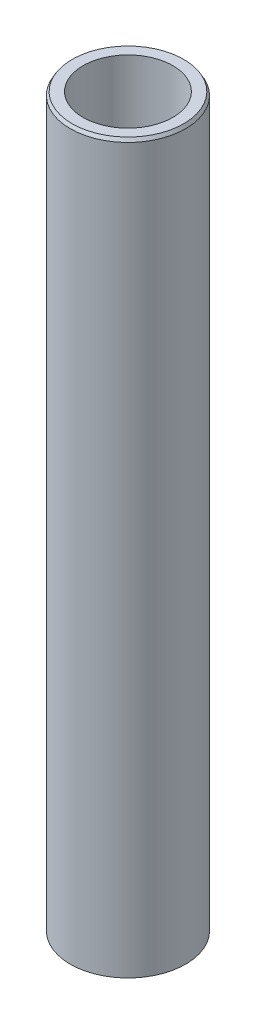
from build123d import *
from OCP.BRepFilletAPI import BRepFilletAPI_MakeChamfer

# Parameters (mm, degrees)
SKETCH1_R           = 47.5
BOSS_EXTRUDE1_DEPTH = 600
SKETCH2_R           = 36.948409672
CUT_EXTRUDE1_DEPTH  = 604.748706003
CHAMFER1_SIZE       = 2.745492763
CHAMFER1_SIZE2      = 1.585110986


with BuildPart() as part:
    # Sketch1 → Boss-Extrude1 (new body)
    with BuildSketch(Plane(origin=(0, 0, 0), x_dir=(1, 0, 0), z_dir=(0, 1, 0))):
        Circle(SKETCH1_R)
    extrude(amount=BOSS_EXTRUDE1_DEPTH)

    # Sketch2 → Cut-Extrude1 (cut, through all)
    with BuildSketch(Plane(origin=(0, 0, 0), x_dir=(1, 0, 0), z_dir=(0, 1, 0))):
        Circle(SKETCH2_R)
    extrude(amount=CUT_EXTRUDE1_DEPTH, mode=Mode.SUBTRACT)

    # Chamfer1: one chamfer whose edges measure the first distance from different faces: ONE call of the kernel's chamfer builder (chamfer() names one face for all edges)
    chamfer1_edges_1 = [part.edges().sort_by_distance(p)[0] for p in [
        (-47.5, 600, 0),
    ]]
    chamfer1_side_1 = [part.faces().sort_by_distance(p)[0] for p in [
        (-47.5, 300, 0),
    ]]
    chamfer1_edges_2 = [part.edges().sort_by_distance(p)[0] for p in [
        (-47.5, 0, 0),
    ]]
    chamfer1_side_2 = [part.faces().sort_by_distance(p)[0] for p in [
        (-46.156497116, 0, 0),
    ]]
    chamfer1 = BRepFilletAPI_MakeChamfer(part.part.solid().wrapped)
    for e in chamfer1_edges_1:
        chamfer1.Add(CHAMFER1_SIZE, CHAMFER1_SIZE2, e.wrapped, chamfer1_side_1[0].wrapped)  # the first distance lies on this face
    for e in chamfer1_edges_2:
        chamfer1.Add(CHAMFER1_SIZE, CHAMFER1_SIZE2, e.wrapped, chamfer1_side_2[0].wrapped)  # the first distance lies on this face
    add(Compound.cast(chamfer1.Shape()), mode=Mode.REPLACE)


solid = part.part
